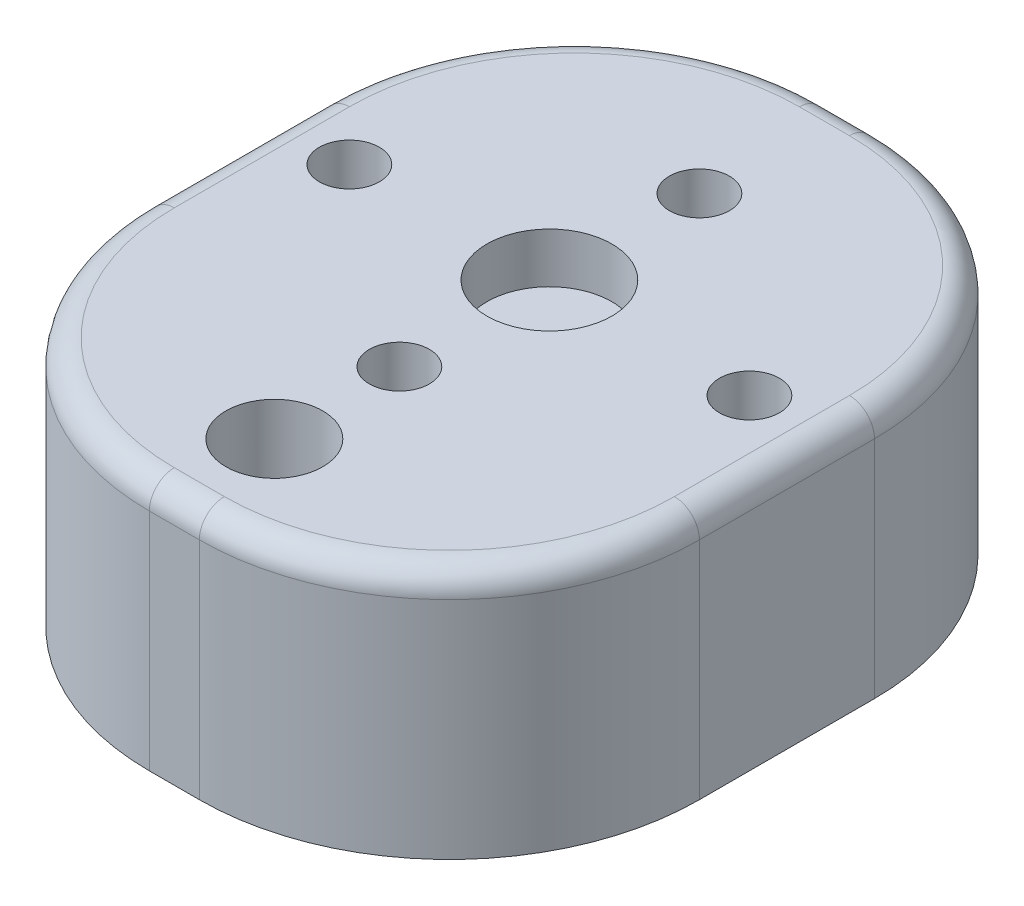
from build123d import *

# Parameters (mm, degrees)
BOSS_EXTRU_1_DEPTH      = 22
D_GAGEMENT_M21_D        = 2.4
ESQUISSE5_W             = 22
ESQUISSE5_H             = 10
BOSS_EXTRU_2_DEPTH      = 5
CONG_1_R                = 10
CONG_3_R                = 1
ENL_V_MAT_EXTRU_2_DEPTH = 3
ESQUISSE12_R            = 1.9376057
ENL_V_MAT_EXTRU_3_DEPTH = 37.235341952
ESQUISSE13_R            = 2.5
ENL_V_MAT_EXTRU_4_DEPTH = 2
ESQUISSE15_R            = 2.5
ENL_V_MAT_EXTRU_5_DEPTH = 7


with BuildPart() as part:
    # Esquisse1 → Boss.-Extru.1 (new body)
    with BuildSketch(Plane.XY):
        with BuildLine():
            Line((0, 10), (0, 0))
            Line((0, 0), (6, 0))
            ThreePointArc((6, 0), (11, 5), (16, 0))
            Line((16, 0), (22, 0))
            Line((22, 0), (22, 10))
            Line((22, 10), (0, 10))
        make_face()
    extrude(amount=BOSS_EXTRU_1_DEPTH)

    # Dégagement M21 (through all)
    with Locations(Plane(origin=(0, 10, 0), x_dir=(1, 0, 0), z_dir=(0, 1, 0))):
        with Locations((11, -6), (11, -18), (3, -12), (19, -12)):
            Hole(D_GAGEMENT_M21_D / 2)

    # Esquisse5 → Boss.-Extru.2 (add)
    with BuildSketch(Plane.XY.offset(22)):
        with Locations((11, 5)):
            Rectangle(ESQUISSE5_W, ESQUISSE5_H)
    extrude(amount=BOSS_EXTRU_2_DEPTH)

    # Congé1
    # the kernel refuses this fillet: 10 mm, written as the material it takes off along each edge
    with BuildSketch(Plane(origin=(0, 35, 0), x_dir=(0, 0, 1), z_dir=(0, -1, 0))) as cong_1_piece_1:
        with BuildLine():
            CenterArc((CONG_1_R, -CONG_1_R), CONG_1_R, 90, 90)
            Line((0, -CONG_1_R), (0, 0))
            Line((0, 0), (CONG_1_R, 0))
        make_face()
    extrude(amount=60, mode=Mode.SUBTRACT)
    with BuildSketch(Plane(origin=(0, 35, 27), x_dir=(0, 0, -1), z_dir=(0, -1, 0)), Plane(origin=(22, -25, 0), x_dir=(-1, 0, 0), z_dir=(0, 1, 0)), Plane(origin=(22, -25, 27), x_dir=(0, 0, -1), z_dir=(0, 1, 0))) as cong_1_piece_2:
        with BuildLine():
            CenterArc((CONG_1_R, CONG_1_R), CONG_1_R, 180, 90)
            Line((0, CONG_1_R), (0, 0))
            Line((0, 0), (CONG_1_R, 0))
        make_face()
    extrude(amount=60, mode=Mode.SUBTRACT)

    # Congé3
    cong_3_edges = [part.edges().sort_by_distance(p)[0] for p in [
        (11, 10, 0),
        (0, 10, 13.5),
        (11, 10, 27),
        (22, 10, 13.5),
        (19.071067812, 10, 24.071067812),
        (19.071067812, 10, 2.928932188),
        (2.928932188, 10, 24.071067812),
        (2.928932188, 10, 2.928932188),
    ]]
    fillet(cong_3_edges, radius=CONG_3_R)

    # Esquisse10 → Enlèv. mat.-Extru.2 (cut)
    with BuildSketch(Plane(origin=(0, 0, 22), x_dir=(-1, 0, 0), z_dir=(0, 0, -1))):
        with BuildLine():
            Line((-7, 0), (-15, 0))
            ThreePointArc((-15, 0), (-11, 4), (-7, 0))
        make_face()
    extrude(amount=-ENL_V_MAT_EXTRU_2_DEPTH, mode=Mode.SUBTRACT)

    # Esquisse12 → Enlèv. mat.-Extru.3 (cut, through all)
    with BuildSketch(Plane(origin=(0, 10, 0), x_dir=(1, 0, 0), z_dir=(0, 1, 0))):
        with Locations(Location((11, -23, 0), (0, 0, 270))):
            Circle(ESQUISSE12_R)
    extrude(amount=-ENL_V_MAT_EXTRU_3_DEPTH, mode=Mode.SUBTRACT)

    # Esquisse13 → Enlèv. mat.-Extru.4 (cut)
    with BuildSketch(Plane(origin=(0, 10, 0), x_dir=(1, 0, 0), z_dir=(0, 1, 0))):
        with Locations(Location((11, -12, 0), (0, 0, 270))):
            Circle(ESQUISSE13_R)
    extrude(amount=-ENL_V_MAT_EXTRU_4_DEPTH, mode=Mode.SUBTRACT)

    # Esquisse15 → Enlèv. mat.-Extru.5 (cut)
    with BuildSketch(Plane.XZ):
        with Locations(Location((11, 18, 0), (0, 0, 270))):
            Circle(ESQUISSE15_R)
        with Locations(Location((11, 6, 0), (0, 0, 270))):
            Circle(ESQUISSE15_R)
    extrude(amount=-ENL_V_MAT_EXTRU_5_DEPTH, mode=Mode.SUBTRACT)


solid = part.part
